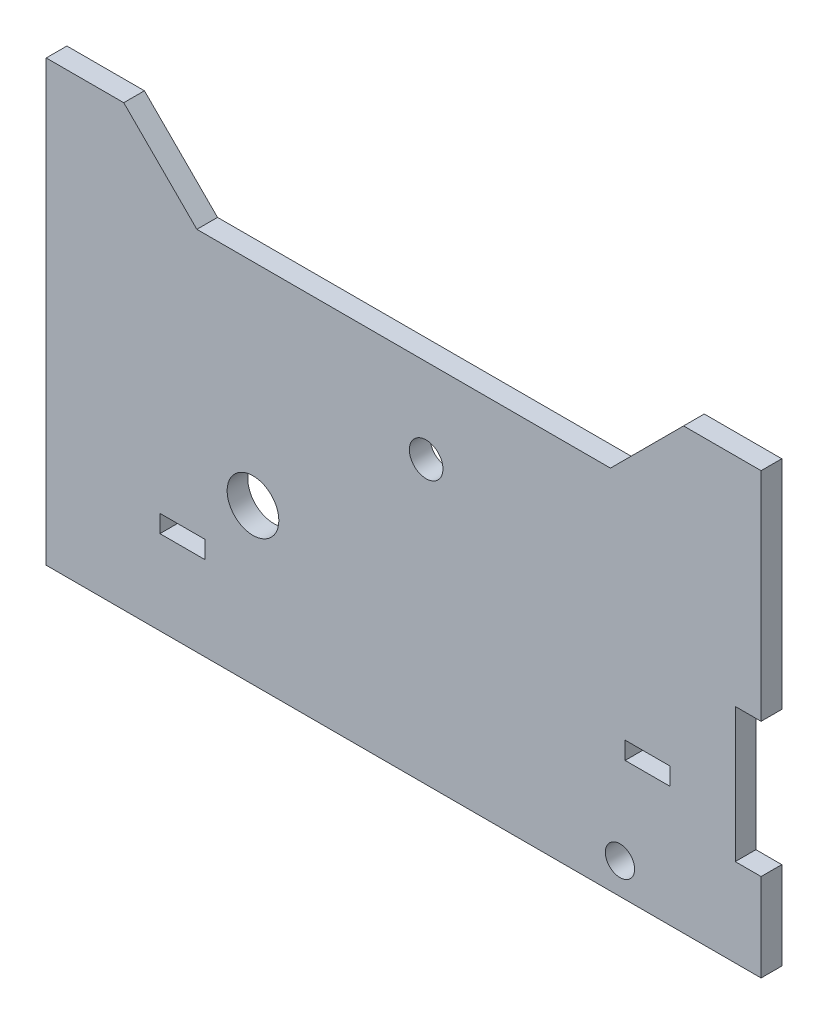
from build123d import *

# Parameters (mm, degrees)
SKETCH1_R           = 5
SKETCH1_R_2         = 2.83
SKETCH1_R_3         = 3.25
SKETCH1_W           = 8.7
SKETCH1_H           = 3.4
BOSS_EXTRUDE1_DEPTH = 2
BOSS_EXTRUDE2_DEPTH = 2


with BuildPart() as part:
    # Sketch1 → Boss-Extrude1 (new, symmetric)
    with BuildSketch(Plane.XY):
        Polygon((-86, -30), (-86, 30), (52.3, 30), (52.3, 13), (47.3, 13), (47.3, -13), (52.3, -13), (52.3, -30), align=None)
        with Locations((-46, 0)):
            Circle(SKETCH1_R, mode=Mode.SUBTRACT)
        with Locations((25, -24)):
            Circle(SKETCH1_R_2, mode=Mode.SUBTRACT)
        with Locations((-12.5, 24.5)):
            Circle(SKETCH1_R_3, mode=Mode.SUBTRACT)
        with Locations((30.35, -5)):
            Rectangle(SKETCH1_W, SKETCH1_H, mode=Mode.SUBTRACT)
        with Locations((-59.65, -12)):
            Rectangle(SKETCH1_W, SKETCH1_H, mode=Mode.SUBTRACT)
    extrude(amount=BOSS_EXTRUDE1_DEPTH, both=True)

    # Sketch2 → Boss-Extrude2 (add, symmetric)
    with BuildSketch(Plane.XY):
        Polygon((-86, 30), (52.3, 30), (52.3, 55), (37.3, 55), (23.157864376, 40.857864376), (-56.857864376, 40.857864376), (-71, 55), (-86, 55), align=None)
    extrude(amount=BOSS_EXTRUDE2_DEPTH, both=True)


solid = part.part
